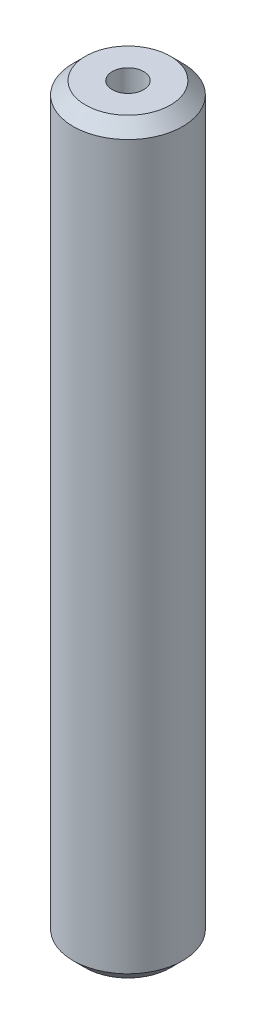
from build123d import *

# Parameters (mm, degrees)
SKETCH1_R           = 5
BOSS_EXTRUDE1_DEPTH = 68.22263724
SKETCH2_R           = 1.437105979
CUT_EXTRUDE1_DEPTH  = 69.588105616
CHAMFER1_SIZE       = 1.128454846


with BuildPart() as part:
    # Sketch1 → Boss-Extrude1 (new body)
    with BuildSketch(Plane(origin=(0, 0, 0), x_dir=(1, 0, 0), z_dir=(0, 1, 0))):
        Circle(SKETCH1_R)
    extrude(amount=BOSS_EXTRUDE1_DEPTH)

    # Sketch2 → Cut-Extrude1 (cut, through all)
    with BuildSketch(Plane(origin=(0, 0, 0), x_dir=(1, 0, 0), z_dir=(0, 1, 0))):
        Circle(SKETCH2_R)
    extrude(amount=CUT_EXTRUDE1_DEPTH, mode=Mode.SUBTRACT)

    # Chamfer1
    chamfer1_edges = [part.edges().sort_by_distance(p)[0] for p in [
        (-5, 68.22263724, 0),
        (-5, 0, 0),
    ]]
    chamfer(chamfer1_edges, length=CHAMFER1_SIZE)


solid = part.part
